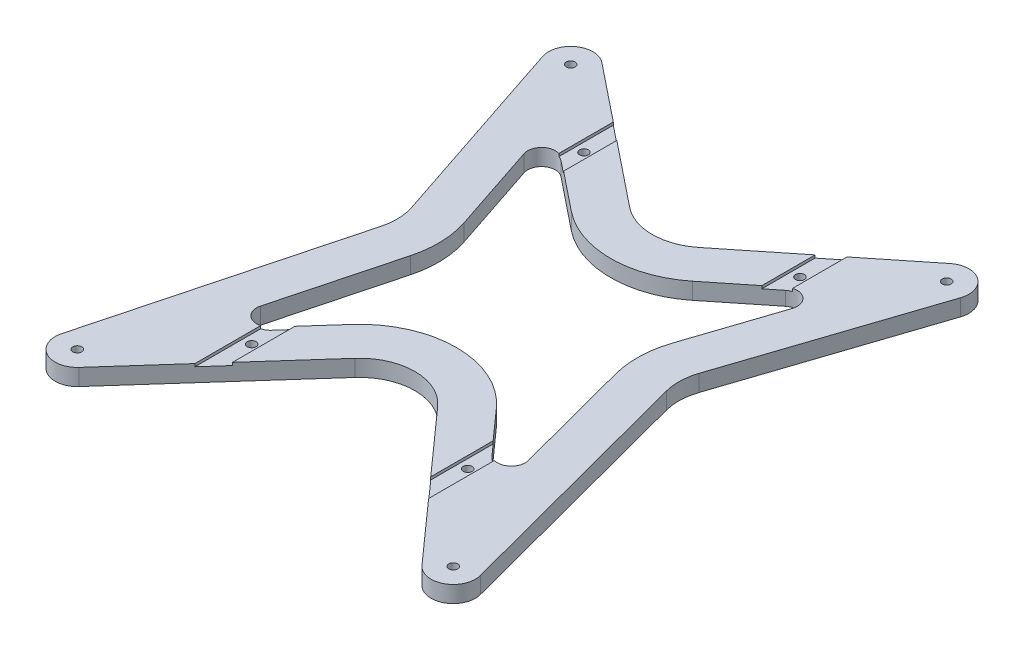
from build123d import *

# Parameters (mm, degrees)
SKETCH1_R           = 1.6
BOSS_EXTRUDE1_DEPTH = 6
FILLET1_R           = 20
CUT_EXTRUDE1_REACH  = 125.376
FILLET4_R           = 5
SKETCH6_W           = 6.4
SKETCH6_H           = 33.317887839
SKETCH6_H_2         = 25.783254567
CUT_EXTRUDE2_DEPTH  = 1
SKETCH7_R           = 3.1
CUT_EXTRUDE3_DEPTH  = 1
CHAMFER1_SIZE       = 1.5


with BuildPart() as part:
    # Sketch1 → Boss-Extrude1 (new body)
    with BuildSketch(Plane(origin=(0, 0, 0), x_dir=(1, 0, 0), z_dir=(0, 1, 0))):
        with BuildLine():
            Line((-62.882592423, 95.340725775), (0, 45))
            Line((0, 45), (62.882592423, 95.340725775))
            ThreePointArc((62.882592423, 95.340725775), (72.454956907, 95.659779271), (75.473207923, 86.570108333))
            Line((75.473207923, 86.570108333), (50, 10))
            Line((50, 10), (75.617337378, -87.053778983))
            ThreePointArc((75.617337378, -87.053778983), (71.66966075, -96.142122248), (61.911734553, -94.420201694))
            Line((61.911734553, -94.420201694), (0, -25))
            Line((0, -25), (-61.911734553, -94.420201694))
            ThreePointArc((-61.911734553, -94.420201694), (-71.66966075, -96.142122248), (-75.617337378, -87.053778983))
            Line((-75.617337378, -87.053778983), (-50, 10))
            Line((-50, 10), (-75.473207923, 86.570108333))
            ThreePointArc((-75.473207923, 86.570108333), (-72.454956907, 95.659779271), (-62.882592423, 95.340725775))
        make_face()
        with Locations(Location((-67.882250994, 89.09545443, 0), (0, 0, 270))):
            Circle(SKETCH1_R, mode=Mode.SUBTRACT)
        with Locations(Location((67.882250994, 89.09545443, 0), (0, 0, 270))):
            Circle(SKETCH1_R, mode=Mode.SUBTRACT)
        with Locations(Location((-67.882250994, -89.09545443, 0), (0, 0, 270))):
            Circle(SKETCH1_R, mode=Mode.SUBTRACT)
        with Locations(Location((67.882250994, -89.09545443, 0), (0, 0, 270))):
            Circle(SKETCH1_R, mode=Mode.SUBTRACT)
        with Locations(Location((-39, 65, 0), (0, 0, 270))):
            Circle(SKETCH1_R, mode=Mode.SUBTRACT)
        with Locations(Location((39, 65, 0), (0, 0, 270))):
            Circle(SKETCH1_R, mode=Mode.SUBTRACT)
        with Locations(Location((39, -55, 0), (0, 0, 270))):
            Circle(SKETCH1_R, mode=Mode.SUBTRACT)
        with Locations(Location((-39, -55, 0), (0, 0, 270))):
            Circle(SKETCH1_R, mode=Mode.SUBTRACT)
    extrude(amount=BOSS_EXTRUDE1_DEPTH)

    # Fillet1
    fillet1_edges = [part.edges().sort_by_distance(p)[0] for p in [
        (0, 3, -45),
        (50, 3, -10),
        (0, 3, 25),
        (-50, 3, -10),
    ]]
    fillet(fillet1_edges, radius=FILLET1_R)

    # Sketch2 → Cut-Extrude1 (cut, up to next)
    with BuildSketch(Plane(origin=(0, 6, 0), x_dir=(1, 0, 0), z_dir=(0, 1, 0)), mode=Mode.PRIVATE) as cut_extrude1_sk1:
        with BuildLine():
            Line((-53.761195119, 68.824044103), (-37.648281191, 20.390114276))
            ThreePointArc((-37.648281191, 20.390114276), (-35.876133945, 10.445731448), (-37.017714824, 0.409395025))
            Line((-37.017714824, 0.409395025), (-53.656219744, -62.627202233))
            Line((-53.656219744, -62.627202233), (-26.12100943, -31.752605236))
            ThreePointArc((-26.12100943, -31.752605236), (0, -20.048374517), (26.12100943, -31.752605236))
            Line((26.12100943, -31.752605236), (53.656219744, -62.627202233))
            Line((53.656219744, -62.627202233), (37.017714824, 0.409395025))
            ThreePointArc((37.017714824, 0.409395025), (35.876133945, 10.445731448), (37.648281191, 20.390114276))
            Line((37.648281191, 20.390114276), (53.761195119, 68.824044103))
            Line((53.761195119, 68.824044103), (21.873506248, 43.296321101))
            ThreePointArc((21.873506248, 43.296321101), (0, 35.619383236), (-21.873506248, 43.296321101))
            Line((-21.873506248, 43.296321101), (-53.761195119, 68.824044103))
        make_face()
    cut_extrude1_tool1 = extrude(cut_extrude1_sk1.sketch, amount=-CUT_EXTRUDE1_REACH, mode=Mode.PRIVATE) & part.part
    add(cut_extrude1_tool1.solids().sort_by_distance((0, 6, -6.295596))[0], mode=Mode.SUBTRACT)

    # Fillet4
    fillet4_edges = [part.edges().sort_by_distance(p)[0] for p in [
        (-53.761195119, 3, -68.824044103),
        (53.761195119, 3, -68.824044103),
        (53.656219744, 3, 62.627202233),
        (-53.656219744, 3, 62.627202233),
    ]]
    fillet(fillet4_edges, radius=FILLET4_R)

    # Sketch6 → Cut-Extrude2 (cut)
    with BuildSketch(Plane(origin=(0, 6, 0), x_dir=(1, 0, 0), z_dir=(0, 1, 0))):
        with Locations((-39, -55.65894392)):
            Rectangle(SKETCH6_W, SKETCH6_H)
        with Locations((39, -55.65894392)):
            Rectangle(SKETCH6_W, SKETCH6_H)
        with Locations((39, 65.891627284)):
            Rectangle(SKETCH6_W, SKETCH6_H_2)
        with Locations((-39, 65.891627284)):
            Rectangle(SKETCH6_W, SKETCH6_H_2)
    extrude(amount=-CUT_EXTRUDE2_DEPTH, mode=Mode.SUBTRACT)

    # Sketch7 → Cut-Extrude3 (cut)
    with BuildSketch(Plane.XZ):
        with Locations(Location((-39, 55, 0), (0, 0, 270))):
            Circle(SKETCH7_R)
        with Locations(Location((39, 55, 0), (0, 0, 270))):
            Circle(SKETCH7_R)
        with Locations(Location((-39, -65, 0), (0, 0, 270))):
            Circle(SKETCH7_R)
        with Locations(Location((39, -65, 0), (0, 0, 270))):
            Circle(SKETCH7_R)
    extrude(amount=-CUT_EXTRUDE3_DEPTH, mode=Mode.SUBTRACT)

    # Chamfer1
    chamfer1_edges = [part.edges().sort_by_distance(p)[0] for p in [
        (-39, 1, 53.4),
        (39, 1, 53.4),
        (-39, 1, -66.6),
        (39, 1, -66.6),
    ]]
    chamfer(chamfer1_edges, length=CHAMFER1_SIZE - 0.0001)  # a hair under: the kernel refuses the full size


solid = part.part
